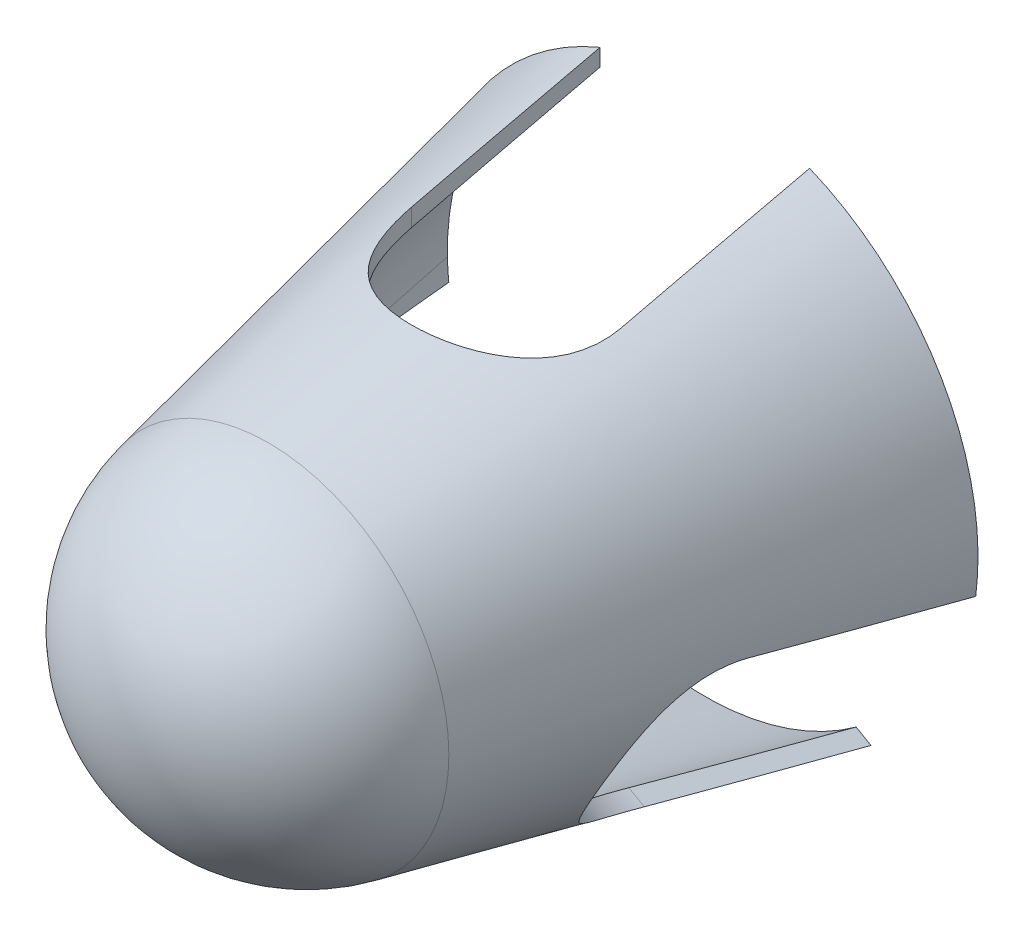
from build123d import *

# Parameters (mm, degrees)
SCHNITT_LINEAR_AUSTRAGEN1_DEPTH = 2634.579347784
KREISMUSTER1_COUNT              = 3


with BuildPart() as part:
    # Skizze1 → Rotation1 (revolve)
    with BuildSketch(Plane(origin=(0, 0, 0), x_dir=(0, 0, -1), z_dir=(1, 0, 0))):
        with BuildLine():
            Line((900, -1303.857467173), (-1183.031489384, -861.095455939))
            ThreePointArc((-1183.031489384, -861.095455939), (-1684.147111857, -554.011407538), (-1880.33284066, 0))
            Line((-1880.33284066, 0), (-1000, 0))
            Line((-1000, 0), (-1000, -825))
            Line((-1000, -825), (900, -1228.857467173))
            Line((900, -1228.857467173), (900, -1303.857467173))
        make_face()
    revolve(axis=Axis((0, 0, 0), (0, 0, -1)))

    # Skizze2 → Schnitt-Linear austragen1 (cut, through all)
    with BuildSketch(Plane(origin=(0, 0, 0), x_dir=(1, 0, 0), z_dir=(0, 1, 0))):
        with BuildLine():
            Line((-500, 0), (-500, 900))
            Line((-500, 900), (500, 900))
            Line((500, 900), (500, 0))
            ThreePointArc((500, 0), (0, -500), (-500, 0))
        make_face()
    schnitt_linear_austragen1 = extrude(amount=SCHNITT_LINEAR_AUSTRAGEN1_DEPTH, mode=Mode.SUBTRACT)

    # Kreismuster1: Schnitt-Linear austragen1 ×3 about axis
    kreismuster1_axis = Axis((0, 0, 1000), (0, 0, -1))
    for i in range(1, KREISMUSTER1_COUNT):
        add(schnitt_linear_austragen1.rotate(kreismuster1_axis, i * 360 / KREISMUSTER1_COUNT), mode=Mode.SUBTRACT)


solid = part.part
